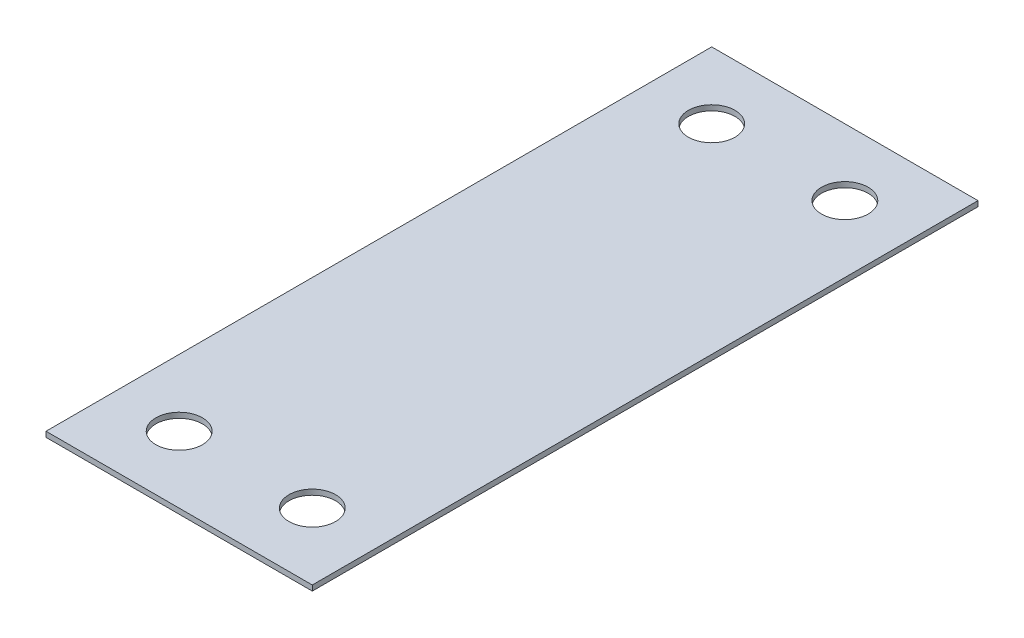
from build123d import *

# Parameters (mm, degrees)
SKETCH1_R           = 1.75
BOSS_EXTRUDE1_DEPTH = 0.4


with BuildPart() as part:
    # Sketch1 → Boss-Extrude1 (new body)
    with BuildSketch(Plane(origin=(0, 0, 0), x_dir=(1, 0, 0), z_dir=(0, 1, 0))):
        Polygon((0, 0), (20, 0), (20, 10), (20, 40), (20, 50), (0, 50), align=None)
        with Locations((5, 45)):
            Circle(SKETCH1_R, mode=Mode.SUBTRACT)
        with Locations((15, 45)):
            Circle(SKETCH1_R, mode=Mode.SUBTRACT)
        with Locations((15, 5)):
            Circle(SKETCH1_R, mode=Mode.SUBTRACT)
        with Locations((5, 5)):
            Circle(SKETCH1_R, mode=Mode.SUBTRACT)
    extrude(amount=BOSS_EXTRUDE1_DEPTH)


solid = part.part
